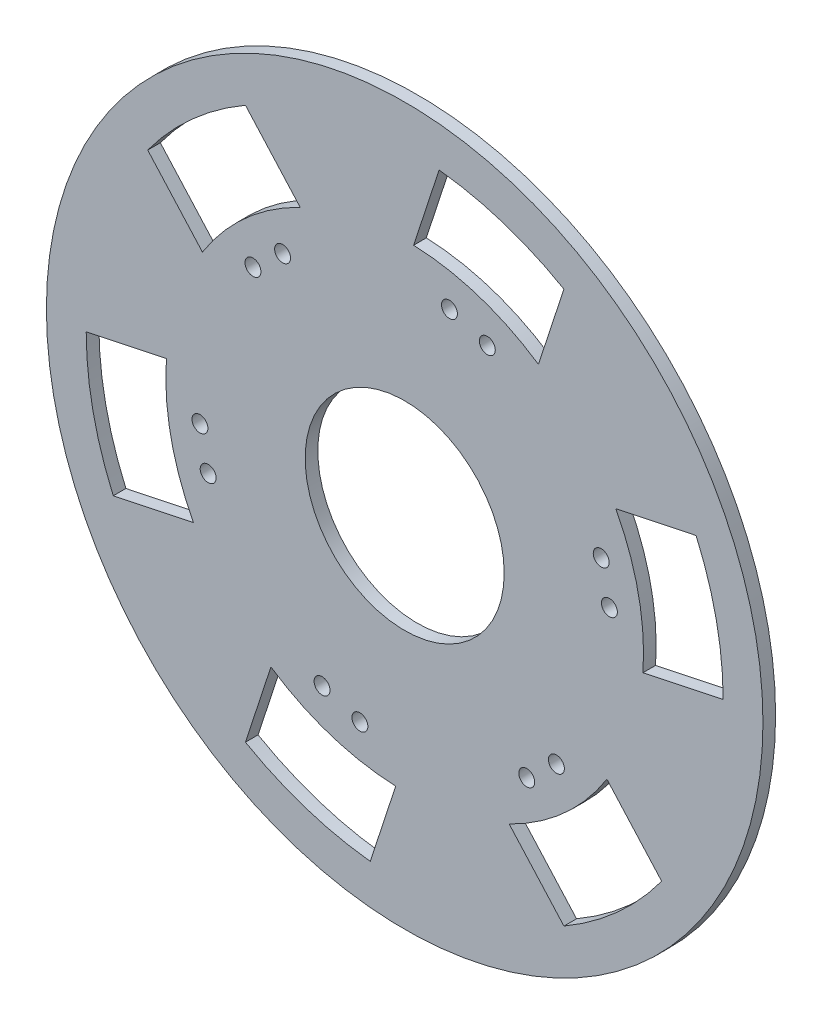
from build123d import *

# Parameters (mm, degrees)
SKETCH1_R           = 90
SKETCH1_R_2         = 25
BOSS_EXTRUDE1_DEPTH = 3.175
SKETCH2_R           = 2
CUT_EXTRUDE1_DEPTH  = 128.31881489
CUT_EXTRUDE2_DEPTH  = 128.31881489


with BuildPart() as part:
    # Sketch1 → Boss-Extrude1 (new body)
    with BuildSketch(Plane.XY):
        Circle(SKETCH1_R)
        Circle(SKETCH1_R_2, mode=Mode.SUBTRACT)
    extrude(amount=BOSS_EXTRUDE1_DEPTH)

    # Sketch2 → Cut-Extrude1 (cut, through all)
    with BuildSketch(Plane(origin=(0, 0, 0), x_dir=(-1, 0, 0), z_dir=(0, 0, -1))):
        with Locations((-49.363135833, 15.509056087)):
            Circle(SKETCH2_R)
        with Locations((-51.424582128, 5.723840751)):
            Circle(SKETCH2_R)
        with Locations((-38.112804477, -34.995201598)):
            Circle(SKETCH2_R)
        with Locations((-30.669282562, -41.673074126)):
            Circle(SKETCH2_R)
        with Locations((11.250331356, -50.504257686)):
            Circle(SKETCH2_R)
        with Locations((20.755299566, -47.396914878)):
            Circle(SKETCH2_R)
        with Locations((49.363135833, -15.509056087)):
            Circle(SKETCH2_R)
        with Locations((51.424582128, -5.723840751)):
            Circle(SKETCH2_R)
        with Locations((38.112804477, 34.995201598)):
            Circle(SKETCH2_R)
        with Locations((30.669282562, 41.673074126)):
            Circle(SKETCH2_R)
        with Locations((-20.755299566, 47.396914878)):
            Circle(SKETCH2_R)
        with Locations((-11.250331356, 50.504257686)):
            Circle(SKETCH2_R)
    extrude(amount=-CUT_EXTRUDE1_DEPTH, mode=Mode.SUBTRACT)

    # Sketch3 → Cut-Extrude2 (cut, through all)
    with BuildSketch(Plane.XY.offset(3.175)):
        with BuildLine():
            ThreePointArc((-80, 0), (-78.281722688, -16.49157036), (-73.200702677, -32.27471344))
            Line((-73.200702677, -32.27471344), (-53.050342732, -28.029647448))
            ThreePointArc((-53.050342732, -28.029647448), (-58.711292016, -12.36867777), (-59.849640055, 4.245065992))
            Line((-59.849640055, 4.245065992), (-80, 0))
        make_face()
        with BuildLine():
            ThreePointArc((-40, 69.282032303), (-53.422980224, 59.54817532), (-64.551073077, 47.256311373))
            Line((-64.551073077, 47.256311373), (-50.799558115, 31.928120761))
            ThreePointArc((-50.799558115, 31.928120761), (-40.067235168, 44.66113149), (-26.248485037, 53.953841691))
            Line((-26.248485037, 53.953841691), (-40, 69.282032303))
        make_face()
        with BuildLine():
            ThreePointArc((-40, -69.282032303), (-24.858742464, -76.03974568), (-8.649629599, -79.531024813))
            Line((-8.649629599, -79.531024813), (-2.250784617, -59.957768209))
            ThreePointArc((-2.250784617, -59.957768209), (-18.644056848, -57.02980926), (-33.601155018, -49.708775699))
            Line((-33.601155018, -49.708775699), (-40, -69.282032303))
        make_face()
        with BuildLine():
            ThreePointArc((40, 69.282032303), (24.858742464, 76.03974568), (8.649629599, 79.531024813))
            Line((8.649629599, 79.531024813), (2.250784617, 59.957768209))
            ThreePointArc((2.250784617, 59.957768209), (18.644056848, 57.02980926), (33.601155018, 49.708775699))
            Line((33.601155018, 49.708775699), (40, 69.282032303))
        make_face()
        with BuildLine():
            ThreePointArc((40, -69.282032303), (53.422980224, -59.54817532), (64.551073077, -47.256311373))
            Line((64.551073077, -47.256311373), (50.799558115, -31.928120761))
            ThreePointArc((50.799558115, -31.928120761), (40.067235168, -44.66113149), (26.248485037, -53.953841691))
            Line((26.248485037, -53.953841691), (40, -69.282032303))
        make_face()
        with BuildLine():
            ThreePointArc((80, 0), (78.281722688, 16.49157036), (73.200702677, 32.27471344))
            Line((73.200702677, 32.27471344), (53.050342732, 28.029647448))
            ThreePointArc((53.050342732, 28.029647448), (58.711292016, 12.36867777), (59.849640055, -4.245065992))
            Line((59.849640055, -4.245065992), (80, 0))
        make_face()
    extrude(amount=-CUT_EXTRUDE2_DEPTH, mode=Mode.SUBTRACT)


solid = part.part
